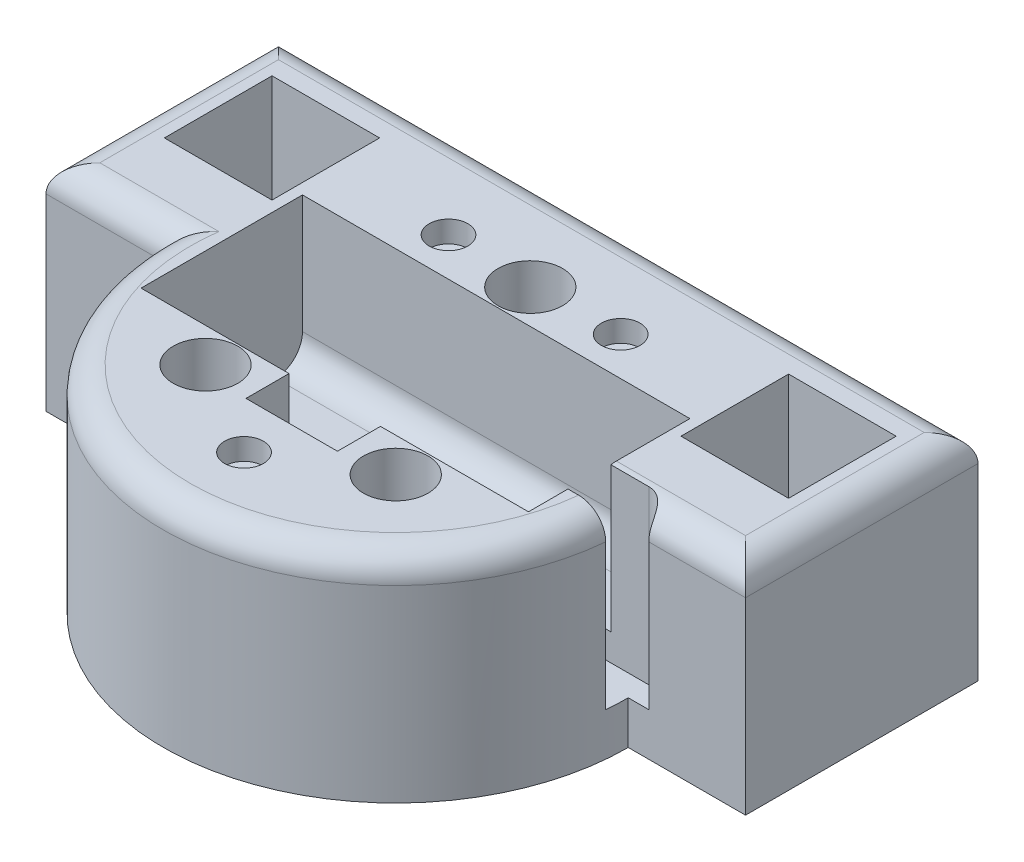
from build123d import *

# Parameters (mm, degrees)
BOSS_EXTRUDE1_DEPTH = 40
SKETCH2_R           = 3
SKETCH2_W           = 20
SKETCH2_H           = 20
CUT_EXTRUDE1_DEPTH  = 50
CUT_EXTRUDE2_DEPTH  = 27
FILLET1_R           = 5
CUT_EXTRUDE3_DEPTH  = 32
SKETCH5_R           = 3.6
CUT_EXTRUDE4_DEPTH  = 4
FILLET3_R           = 5
SKETCH7_R           = 6
CUT_EXTRUDE5_DEPTH  = 36


with BuildPart() as part:
    # Sketch1 → Boss-Extrude1 (new body)
    with BuildSketch(Plane(origin=(0, 0, 0), x_dir=(1, 0, 0), z_dir=(0, 1, 0))):
        with BuildLine():
            Line((-65, 43.2), (-65, 0))
            Line((-65, 0), (-43.2, 0))
            ThreePointArc((-43.2, 0), (0, -43.2), (43.2, 0))
            Line((43.2, 0), (65, 0))
            Line((65, 0), (65, 43.2))
            Line((65, 43.2), (-65, 43.2))
        make_face()
    extrude(amount=BOSS_EXTRUDE1_DEPTH)

    # Sketch2 → Cut-Extrude1 (cut)
    with BuildSketch(Plane(origin=(0, 40, 0), x_dir=(1, 0, 0), z_dir=(0, 1, 0))):
        with Locations((0, 25)):
            Circle(SKETCH2_R)
        with Locations((17.67766953, -17.67766953)):
            Circle(SKETCH2_R)
        with Locations((-17.67766953, -17.67766953)):
            Circle(SKETCH2_R)
        with Locations((48, 25)):
            Rectangle(SKETCH2_W, SKETCH2_H)
        with Locations((-48, 25)):
            Rectangle(SKETCH2_W, SKETCH2_H)
    extrude(amount=-CUT_EXTRUDE1_DEPTH, mode=Mode.SUBTRACT)

    # Sketch3 → Cut-Extrude2 (cut)
    with BuildSketch(Plane(origin=(0, 40, 0), x_dir=(1, 0, 0), z_dir=(0, 1, 0))):
        Polygon((8.5, -19.338834765), (8.5, -11.338834765), (36, -11.338834765), (36, 18.661165235), (-36, 18.661165235), (-36, -11.338834765), (-8.5, -11.338834765), (-8.5, -19.338834765), align=None)
    extrude(amount=-CUT_EXTRUDE2_DEPTH, mode=Mode.SUBTRACT)

    # Fillet1
    fillet1_edges = [part.edges().sort_by_distance(p)[0] for p in [
        (0, 13, -18.661165235),
        (22.25, 13, 11.338834765),
        (-22.25, 13, 11.338834765),
    ]]
    fillet(fillet1_edges, radius=FILLET1_R)

    # Sketch4 → Cut-Extrude3 (cut)
    with BuildSketch(Plane(origin=(0, 40, 0), x_dir=(1, 0, 0), z_dir=(0, 1, 0))):
        with BuildLine():
            Line((43.014416188, 4), (23.014416188, 4))
            ThreePointArc((23.014416188, 4), (19.014416188, 0), (23.014416188, -4))
            Line((23.014416188, -4), (43.014416188, -4))
            ThreePointArc((43.014416188, -4), (47.014416188, 0), (43.014416188, 4))
        make_face()
    extrude(amount=-CUT_EXTRUDE3_DEPTH, mode=Mode.SUBTRACT)

    # Sketch5 → Cut-Extrude4 (cut)
    with BuildSketch(Plane(origin=(0, 40, 0), x_dir=(1, 0, 0), z_dir=(0, 1, 0))):
        with Locations((16, 25.8)):
            Circle(SKETCH5_R)
        with Locations((-16, 25.8)):
            Circle(SKETCH5_R)
        with Locations((0, -28.2)):
            Circle(SKETCH5_R)
    extrude(amount=-CUT_EXTRUDE4_DEPTH, mode=Mode.SUBTRACT)

    # Fillet3
    fillet3_edges = [part.edges().sort_by_distance(p)[0] for p in [
        (-2.002151427, 40, 43.153579106),
        (56.007208094, 40, 0),
        (-54.1, 40, 0),
        (-65, 40, -21.6),
        (65, 40, -21.6),
        (0, 40, -43.2),
    ]]
    fillet(fillet3_edges, radius=FILLET3_R)

    # Sketch7 → Cut-Extrude5 (cut)
    with BuildSketch(Plane(origin=(0, 40, 0), x_dir=(1, 0, 0), z_dir=(0, 1, 0))):
        with Locations((0, 25)):
            Circle(SKETCH7_R)
        with Locations((17.67766953, -17.67766953)):
            Circle(SKETCH7_R)
        with Locations((-17.67766953, -17.67766953)):
            Circle(SKETCH7_R)
    extrude(amount=-CUT_EXTRUDE5_DEPTH, mode=Mode.SUBTRACT)


solid = part.part
